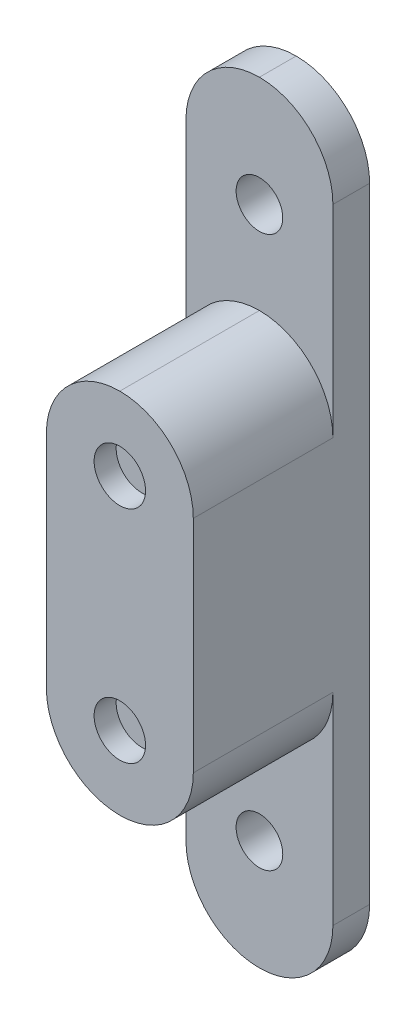
from build123d import *

# Parameters (mm, degrees)
SKETCH1_W           = 20
SKETCH1_H           = 105
BOSS_EXTRUDE1_DEPTH = 5
SKETCH2_R           = 3.175
CUT_EXTRUDE1_DEPTH  = 54.677276384
SKETCH4_W           = 20
SKETCH4_H           = 50
BOSS_EXTRUDE3_DEPTH = 19
SKETCH5_R           = 3.5
CUT_EXTRUDE2_DEPTH  = 3
FILLET5_R           = 10


with BuildPart() as part:
    # Sketch1 → Boss-Extrude1 (new body)
    with BuildSketch(Plane.XY):
        Rectangle(SKETCH1_W, SKETCH1_H)
    extrude(amount=BOSS_EXTRUDE1_DEPTH)

    # Sketch2 → Cut-Extrude1 (cut, through all)
    with BuildSketch(Plane.XY.offset(5)):
        with Locations((0, 37.5)):
            Circle(SKETCH2_R)
        with Locations((0, -37.5)):
            Circle(SKETCH2_R)
    extrude(amount=-CUT_EXTRUDE1_DEPTH, mode=Mode.SUBTRACT)

    # Sketch4 → Boss-Extrude3 (add)
    with BuildSketch(Plane.XY.offset(5)):
        Rectangle(SKETCH4_W, SKETCH4_H)
    extrude(amount=BOSS_EXTRUDE3_DEPTH)

    # Sketch5 → Cut-Extrude2 (cut)
    with BuildSketch(Plane.XY.offset(24)):
        with Locations((0, -15)):
            Circle(SKETCH5_R)
        with Locations((0, 15)):
            Circle(SKETCH5_R)
    extrude(amount=-CUT_EXTRUDE2_DEPTH, mode=Mode.SUBTRACT)

    # Fillet5
    fillet5_edges = [part.edges().sort_by_distance(p)[0] for p in [
        (10, -52.5, 2.5),
        (-10, -52.5, 2.5),
        (10, -25, 14.5),
        (-10, -25, 14.5),
        (10, 25, 14.5),
        (-10, 25, 14.5),
        (-10, 52.5, 2.5),
        (10, 52.5, 2.5),
    ]]
    fillet(fillet5_edges, radius=FILLET5_R - 0.0001)  # a hair under: the kernel refuses the full size


solid = part.part
